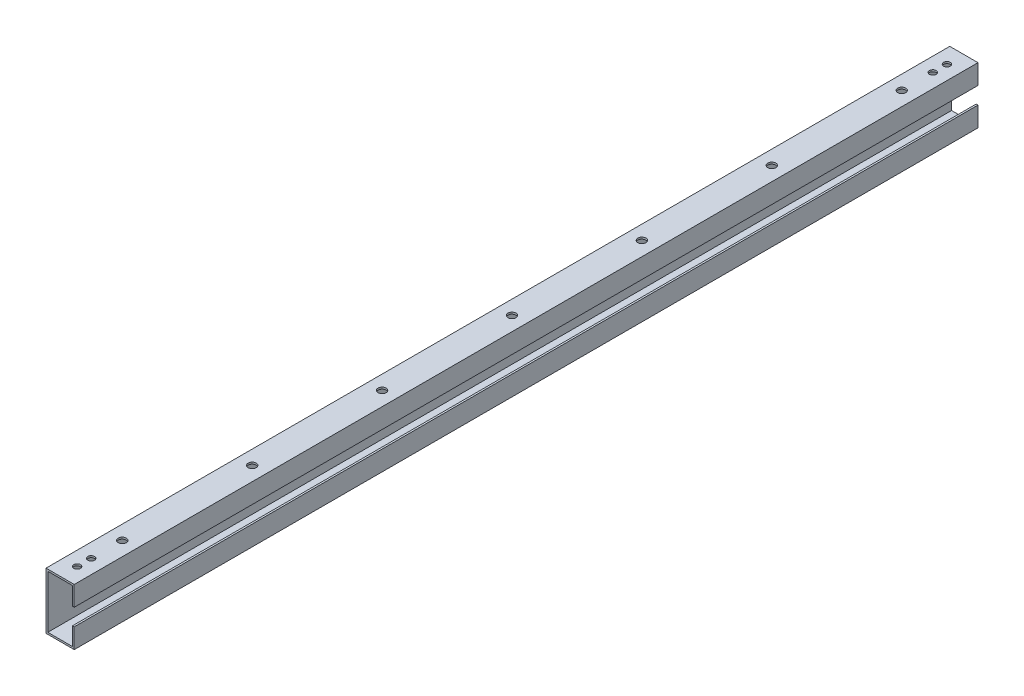
from build123d import *

# Parameters (mm, degrees)
CROQUIS1_W                         = 50
CROQUIS1_H                         = 100
CROQUIS1_W_2                       = 43.65
CROQUIS1_H_2                       = 93.65
SALIENTE_EXTRUIR1_DEPTH            = 800
CROQUIS2_W                         = 1600
CROQUIS2_H                         = 30
CORTAR_EXTRUIR1_DEPTH              = 5
CROQUIS8_R                         = 7.14375
CORTAR_EXTRUIR2_DEPTH              = 130
TALADRO_DE_MARGEN_PARA_7_161_D     = 11.90498
TALADRO_DE_MARGEN_PARA_7_161_DEPTH = 151.5
TALADRO_DE_MARGEN_PARA_7_161_TIP   = 3.576616826
TALADRO_DE_MARGEN_PARA_7_162_D     = 11.90498
TALADRO_DE_MARGEN_PARA_7_162_DEPTH = 151.5
TALADRO_DE_MARGEN_PARA_7_162_TIP   = 3.576616826


with BuildPart() as part:
    # Croquis1 → Saliente-Extruir1 (new, symmetric)
    with BuildSketch(Plane.XY):
        Rectangle(CROQUIS1_W, CROQUIS1_H)
        Rectangle(CROQUIS1_W_2, CROQUIS1_H_2, mode=Mode.SUBTRACT)
    extrude(amount=SALIENTE_EXTRUIR1_DEPTH, both=True)

    # Croquis2 → Cortar-Extruir1 (cut)
    with BuildSketch(Plane(origin=(25, 0, 0), x_dir=(0, 0, -1), z_dir=(1, 0, 0))):
        Rectangle(CROQUIS2_W, CROQUIS2_H)
    extrude(amount=-CORTAR_EXTRUIR1_DEPTH, mode=Mode.SUBTRACT)

    # Croquis8 → Cortar-Extruir2 (cut)
    with BuildSketch(Plane(origin=(25, 50, 0), x_dir=(0, 0, 1), z_dir=(0, -1, 0))):
        with Locations((0, 25)):
            Circle(CROQUIS8_R)
        with Locations((230, 25)):
            Circle(CROQUIS8_R)
        with Locations((460, 25)):
            Circle(CROQUIS8_R)
        with Locations((690, 25)):
            Circle(CROQUIS8_R)
        with Locations((920, 25)):
            Circle(CROQUIS8_R)
        with Locations((1150, 25)):
            Circle(CROQUIS8_R)
        with Locations((1380, 25)):
            Circle(CROQUIS8_R)
        with Locations((1610, 25)):
            Circle(CROQUIS8_R)
        with Locations((-230, 25)):
            Circle(CROQUIS8_R)
        with Locations((-460, 25)):
            Circle(CROQUIS8_R)
        with Locations((-690, 25)):
            Circle(CROQUIS8_R)
        with Locations((-920, 25)):
            Circle(CROQUIS8_R)
        with Locations((-1150, 25)):
            Circle(CROQUIS8_R)
        with Locations((-1380, 25)):
            Circle(CROQUIS8_R)
        with Locations((-1610, 25)):
            Circle(CROQUIS8_R)
    extrude(amount=CORTAR_EXTRUIR2_DEPTH, mode=Mode.SUBTRACT)

    # Taladro de margen para 7/161
    with Locations(Plane(origin=(352.411711603, -54.7625, 29.74117116), x_dir=(-1, 0, 0), z_dir=(0, -1, 0))):
        with Locations((-597.588288397, 774.74117116), (-597.588288397, 799.74117116), (352.411711603, 799.74117116), (352.411711603, 774.74117116)):
            Hole(TALADRO_DE_MARGEN_PARA_7_161_D / 2, depth=TALADRO_DE_MARGEN_PARA_7_161_DEPTH)
            with Locations((0, 0, -(TALADRO_DE_MARGEN_PARA_7_161_DEPTH + TALADRO_DE_MARGEN_PARA_7_161_TIP / 2))):  # 118° drill point
                Cone(0, TALADRO_DE_MARGEN_PARA_7_161_D / 2, TALADRO_DE_MARGEN_PARA_7_161_TIP, mode=Mode.SUBTRACT)

    # Taladro de margen para 7/162
    with Locations(Plane(origin=(597.588288397, -54.7625, -29.74117116), x_dir=(1, 0, 0), z_dir=(0, -1, 0))):
        with Locations((-597.588288397, 774.74117116), (-597.588288397, 799.74117116), (352.411711603, 799.74117116), (352.411711603, 774.74117116)):
            Hole(TALADRO_DE_MARGEN_PARA_7_162_D / 2, depth=TALADRO_DE_MARGEN_PARA_7_162_DEPTH)
            with Locations((0, 0, -(TALADRO_DE_MARGEN_PARA_7_162_DEPTH + TALADRO_DE_MARGEN_PARA_7_162_TIP / 2))):  # 118° drill point
                Cone(0, TALADRO_DE_MARGEN_PARA_7_162_D / 2, TALADRO_DE_MARGEN_PARA_7_162_TIP, mode=Mode.SUBTRACT)


solid = part.part
